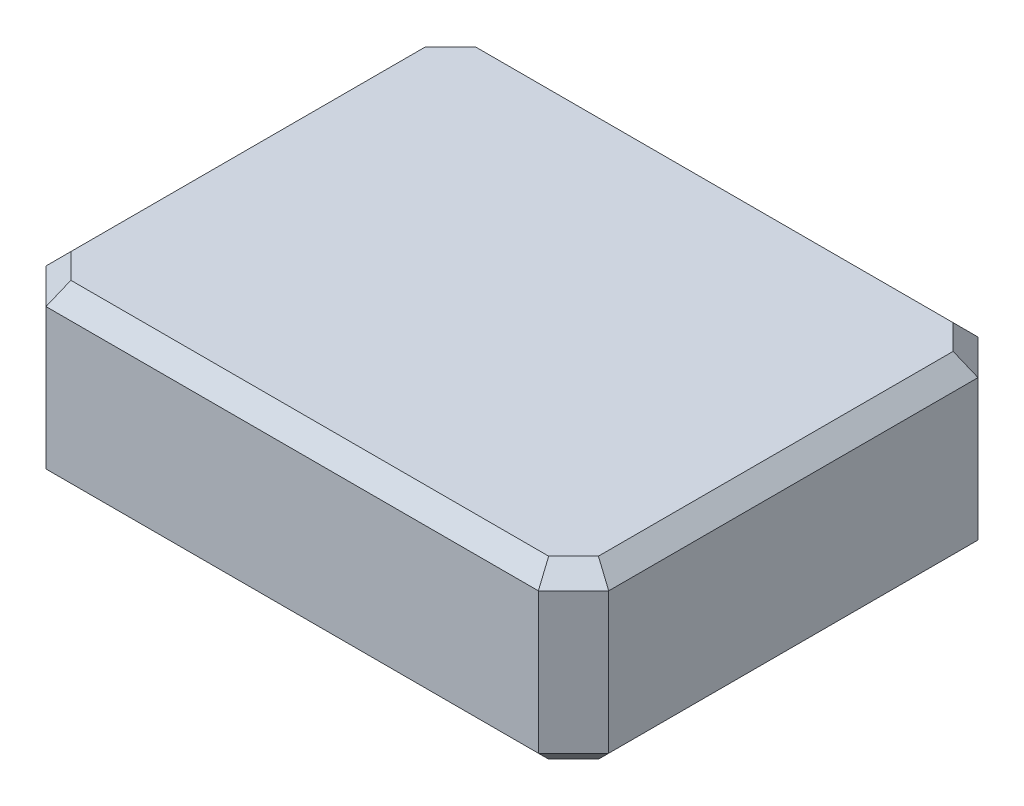
from build123d import *

# Parameters (mm, degrees)
SKETCH1_W           = 320
SKETCH1_H           = 250
BOSS_EXTRUDE1_DEPTH = 50
CHAMFER1_SIZE       = 20
CHAMFER2_SIZE       = 10


with BuildPart() as part:
    # Sketch1 → Boss-Extrude1 (new, symmetric)
    with BuildSketch(Plane(origin=(0, 0, 0), x_dir=(1, 0, 0), z_dir=(0, 1, 0))):
        Rectangle(SKETCH1_W, SKETCH1_H)
    extrude(amount=BOSS_EXTRUDE1_DEPTH, both=True)

    # Chamfer1
    chamfer1_edges = [part.edges().sort_by_distance(p)[0] for p in [
        (-160, 0, -125),
        (-160, 0, 125),
        (160, 0, -125),
        (160, 0, 125),
    ]]
    chamfer(chamfer1_edges, length=CHAMFER1_SIZE)

    # Chamfer2
    chamfer2_edges = [part.edges().sort_by_distance(p)[0] for p in [
        (150, 50, -115),
        (160, 50, 0),
        (150, 50, 115),
        (0, 50, 125),
        (-150, 50, 115),
        (-160, 50, 0),
        (-150, 50, -115),
        (0, 50, -125),
        (-150, -50, 115),
        (0, -50, 125),
        (150, -50, 115),
        (160, -50, 0),
        (150, -50, -115),
        (0, -50, -125),
        (-150, -50, -115),
        (-160, -50, 0),
    ]]
    chamfer(chamfer2_edges, length=CHAMFER2_SIZE)


solid = part.part
